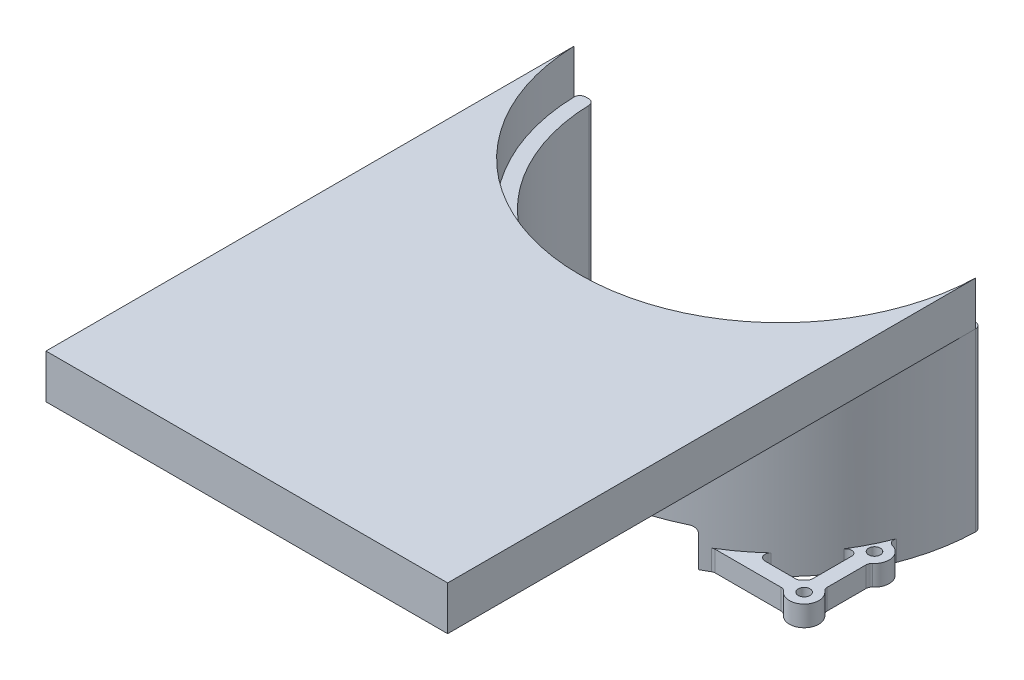
from build123d import *

# Parameters (mm, degrees)
SKETCH1_R           = 2
BOSS_EXTRUDE1_DEPTH = 60
CUT_EXTRUDE1_START  = -53
SKETCH2_R           = 90.041166502
SKETCH2_R_2         = 68.5
CUT_EXTRUDE1_DEPTH  = 53
SKETCH3_W           = 64.67850159
SKETCH3_H           = 25.422058074
CUT_EXTRUDE2_DEPTH  = 55
FILLET1_R           = 2
BOSS_EXTRUDE2_DEPTH = 15


with BuildPart() as part:
    # Sketch1 → Boss-Extrude1 (new body)
    with BuildSketch(Plane(origin=(0, 0, 0), x_dir=(1, 0, 0), z_dir=(0, 1, 0))):
        with BuildLine():
            Line((63.490136384, 0), (68.5, 0))
            ThreePointArc((68.5, 0), (67.085865229, -13.846901692), (62.90184857, -27.122084109))
            ThreePointArc((62.90184857, -27.122084109), (68.657126641, -30.180337544), (66.499734232, -36.330280449))
            Line((66.499734232, -36.330280449), (66.499734232, -51.669719551))
            ThreePointArc((66.499734232, -51.669719551), (67.535642402, -59.535425407), (59.669872981, -58.5))
            Line((59.669872981, -58.5), (35.637059362, -58.5))
            ThreePointArc((35.637059362, -58.5), (0, -68.5), (-35.637059362, -58.5))
            Line((-35.637059362, -58.5), (-59.669872981, -58.5))
            ThreePointArc((-59.669872981, -58.5), (-67.535642402, -59.535425407), (-66.499734232, -51.669719551))
            Line((-66.499734232, -51.669719551), (-66.499734232, -36.330280449))
            ThreePointArc((-66.499734232, -36.330280449), (-68.657126641, -30.180337544), (-62.90184857, -27.122084109))
            ThreePointArc((-62.90184857, -27.122084109), (-67.085865229, -13.846901692), (-68.5, 0))
            Line((-68.5, 0), (-63.490136384, 0))
            ThreePointArc((-63.490136384, 0), (0, -63.490136384), (63.490136384, 0))
        make_face()
        with Locations(Location((-64, -32, 0), (0, 0, 270))):
            Circle(SKETCH1_R, mode=Mode.SUBTRACT)
        with Locations(Location((64, -32, 0), (0, 0, 270))):
            Circle(SKETCH1_R, mode=Mode.SUBTRACT)
        with Locations(Location((64, -56, 0), (0, 0, 270))):
            Circle(SKETCH1_R, mode=Mode.SUBTRACT)
        with Locations(Location((-64, -56, 0), (0, 0, 270))):
            Circle(SKETCH1_R, mode=Mode.SUBTRACT)
        with BuildLine():
            Line((61.500265768, -36.330280449), (61.500265768, -51.669719551))
            ThreePointArc((61.500265768, -51.669719551), (60.464574593, -52.464357598), (59.669872981, -53.5))
            Line((59.669872981, -53.5), (42.778499272, -53.5))
            ThreePointArc((42.778499272, -53.5), (52.025817799, -44.55967103), (59.43877643, -34.048228391))
            ThreePointArc((59.43877643, -34.048228391), (60.289714071, -35.35168291), (61.500265768, -36.330280449))
        make_face(mode=Mode.SUBTRACT)
        with BuildLine():
            Line((-59.669872981, -53.5), (-42.778499272, -53.5))
            ThreePointArc((-42.778499272, -53.5), (-52.025817799, -44.55967103), (-59.43877643, -34.048228391))
            ThreePointArc((-59.43877643, -34.048228391), (-60.289714071, -35.35168291), (-61.500265768, -36.330280449))
            Line((-61.500265768, -36.330280449), (-61.500265768, -51.669719551))
            ThreePointArc((-61.500265768, -51.669719551), (-60.464574593, -52.464357598), (-59.669872981, -53.5))
        make_face(mode=Mode.SUBTRACT)
    extrude(amount=BOSS_EXTRUDE1_DEPTH)

    # Sketch2 → Cut-Extrude1 (cut)
    with BuildSketch(Plane(origin=(0, 60, 0), x_dir=(1, 0, 0), z_dir=(0, 1, 0)).offset(CUT_EXTRUDE1_START)):
        Circle(SKETCH2_R)
        Circle(SKETCH2_R_2, mode=Mode.SUBTRACT)
    extrude(amount=CUT_EXTRUDE1_DEPTH, mode=Mode.SUBTRACT)

    # Sketch3 → Cut-Extrude2 (cut)
    with BuildSketch(Plane(origin=(0, 60, 68.5), x_dir=(1, 0, 0), z_dir=(0, 0, 1))):
        with Locations((0, -60)):
            Rectangle(SKETCH3_W, SKETCH3_H)
    extrude(amount=-CUT_EXTRUDE2_DEPTH, mode=Mode.SUBTRACT)

    # Fillet1
    # the kernel refuses this fillet: 2 mm, written as the material it adds along each edge
    with BuildSketch(Plane(origin=(62.90184857, 0, 27.122084109), x_dir=(0.9997743783027363, 0, 0.02124129208351232), z_dir=(0, 1, 0))) as fillet1_piece_1:
        with BuildLine():
            CenterArc((2.883640558, 1.941395669), FILLET1_R, 160.236767208, 95.858786022)
            ThreePointArc((1.001444665, 2.617663827), (0.514111494, 1.303709596), (0, 0))
            ThreePointArc((0, 0), (1.201516899, 0.146510828), (2.403033798, 0))
        make_face()
    extrude(amount=7)
    with BuildSketch(Plane(origin=(66.499734232, 0, 36.330280449), x_dir=(0.8191578281035011, 0, -0.5735681761192429), z_dir=(0, 1, 0)), Plane(origin=(-66.499734232, 0, 51.669719551), x_dir=(-0.8191578281038059, 0, 0.5735681761188076), z_dir=(0, 1, 0))) as fillet1_piece_2:
        with BuildLine():
            CenterArc((1.046482067, -1.992380453), FILLET1_R, 95.002938786, 49.997638975)
            Line((-0.591833589, -0.845244101), (0, 0))
            ThreePointArc((0, 0), (0.436034195, -0.019048868), (0.87206839, 0))
        make_face()
    extrude(amount=7)
    with BuildSketch(Plane(origin=(66.499734232, 0, 51.669719551), x_dir=(0, 0, -1), z_dir=(0, 1, 0)), Plane(origin=(-66.499734232, 0, 36.330280449), x_dir=(0, 0, 1), z_dir=(0, 1, 0))) as fillet1_piece_3:
        with BuildLine():
            CenterArc((1.031845234, -2), FILLET1_R, 90, 49.997638975)
            ThreePointArc((-0.500190676, -0.714361648), (-0.234491309, -0.368106648), (0, 0))
            Line((0, 0), (1.031845234, 0))
        make_face()
    extrude(amount=7)
    with BuildSketch(Plane(origin=(59.669872981, 0, 58.5), x_dir=(0.5736136140260999, 0, 0.8191260109433204), z_dir=(0, 1, 0))) as fillet1_piece_4:
        with BuildLine():
            CenterArc((1.046411475, -1.992381483), FILLET1_R, 95.002600442, 49.994799115)
            Line((-0.591840547, -0.845154255), (0, 0))
            ThreePointArc((0, 0), (0.436004781, -0.019046293), (0.872009562, 0))
        make_face()
    extrude(amount=7)
    with BuildSketch(Plane(origin=(35.637059362, 0, 58.5), x_dir=(1, 0, 0), z_dir=(0, 1, 0))) as fillet1_piece_5:
        with BuildLine():
            CenterArc((0.556862779, -2), FILLET1_R, 90, 30.889831942)
            ThreePointArc((-0.469915154, -0.283687943), (-0.234673418, -0.142314667), (0, 0))
            Line((0, 0), (0.556862779, 0))
        make_face()
    extrude(amount=7)
    with BuildSketch(Plane(origin=(-35.637059362, 0, 58.5), x_dir=(0.85609218491347, 0, 0.5168231524710181), z_dir=(0, 1, 0))) as fillet1_piece_6:
        with BuildLine():
            CenterArc((0.556920432, -1.999983947), FILLET1_R, 90.229563134, 30.889831942)
            Line((-0.476725873, -0.287799577), (0, 0))
            ThreePointArc((0, 0), (0.274453594, -0.000549818), (0.548907188, 0))
        make_face()
    extrude(amount=7)
    with BuildSketch(Plane(origin=(-59.669872981, 0, 58.5), x_dir=(1, 0, 0), z_dir=(0, 1, 0))) as fillet1_piece_7:
        with BuildLine():
            CenterArc((1.031775628, -2), FILLET1_R, 90, 49.994799115)
            ThreePointArc((-0.500196557, -0.714285714), (-0.234496964, -0.36806807), (0, 0))
            Line((0, 0), (1.031775628, 0))
        make_face()
    extrude(amount=7)
    with BuildSketch(Plane(origin=(-62.90184857, 0, 27.122084109), x_dir=(-0.3770742927095456, 0, -0.9261830152716016), z_dir=(0, 1, 0))) as fillet1_piece_8:
        with BuildLine():
            CenterArc((2.843602303, 1.999581444), FILLET1_R, 172.968999754, 95.858786022)
            ThreePointArc((0.858642167, 2.244394142), (0.566159793, 1.069846424), (0, 0))
            ThreePointArc((0, 0), (1.401343581, 0.014335543), (2.802687162, 0))
        make_face()
    extrude(amount=7)
    with BuildSketch(Plane(origin=(32.339250795, 12.711029037, 65.385617973), x_dir=(-1, 0, 0), z_dir=(0, 0, -1))) as fillet1_piece_9_section:
        with BuildLine():
            CenterArc((FILLET1_R, -FILLET1_R), FILLET1_R, 90, 90)
            Line((0, -FILLET1_R), (0, 0))
            Line((0, 0), (FILLET1_R, 0))
        make_face()
    fillet1_piece_9 = extrude(amount=15.748906176, mode=Mode.PRIVATE)
    fillet1_piece_9 = fillet1_piece_9 & Plane(origin=(0, 12.25719498, 0), x_dir=(1, 0, 0), z_dir=(0, -1, 0)) * Cylinder(68.5, 40, mode=Mode.PRIVATE)
    fillet1_piece_9 = fillet1_piece_9 - Plane(origin=(0, 12.25719498, 0), x_dir=(-1, 0, 0), z_dir=(0, -1, 0)) * Cylinder(63.490136384, 40, mode=Mode.PRIVATE)
    add(fillet1_piece_9)
    with BuildSketch(Plane(origin=(-32.339250795, 12.711029037, 65.385617973), x_dir=(1, 0, 0), z_dir=(0, 0, -1))) as fillet1_piece_10_section:
        with BuildLine():
            CenterArc((FILLET1_R, FILLET1_R), FILLET1_R, 180, 90)
            Line((0, FILLET1_R), (0, 0))
            Line((0, 0), (FILLET1_R, 0))
        make_face()
    fillet1_piece_10 = extrude(amount=15.748906176, mode=Mode.PRIVATE)
    fillet1_piece_10 = fillet1_piece_10 & Plane(origin=(0, 12.25719498, 0), x_dir=(1, 0, 0), z_dir=(0, -1, 0)) * Cylinder(68.5, 40, mode=Mode.PRIVATE)
    fillet1_piece_10 = fillet1_piece_10 - Plane(origin=(0, 12.25719498, 0), x_dir=(-1, 0, 0), z_dir=(0, -1, 0)) * Cylinder(63.490136384, 40, mode=Mode.PRIVATE)
    add(fillet1_piece_10)
    with BuildSketch(Plane(origin=(-61.500265768, 0, 36.330280449), x_dir=(0, 0, 1), z_dir=(0, 1, 0)), Plane(origin=(61.500265768, 0, 51.669719551), x_dir=(0, 0, -1), z_dir=(0, 1, 0))) as fillet1_piece_11:
        with BuildLine():
            CenterArc((1.031845234, 2), FILLET1_R, 220.002361025, 49.997638975)
            ThreePointArc((-0.500190676, 0.714361648), (-0.234491309, 0.368106648), (0, 0))
            Line((0, 0), (1.031845234, 0))
        make_face()
    extrude(amount=7)
    with BuildSketch(Plane(origin=(-61.500265768, 0, 51.669719551), x_dir=(0.8191578281038006, 0, 0.5735681761188153), z_dir=(0, 1, 0)), Plane(origin=(61.500265768, 0, 36.330280449), x_dir=(-0.8191578281034525, 0, -0.5735681761193124), z_dir=(0, 1, 0))) as fillet1_piece_12:
        with BuildLine():
            CenterArc((1.046482067, 1.992380453), FILLET1_R, 214.999422238, 49.997638975)
            Line((-0.591833589, 0.845244101), (0, 0))
            ThreePointArc((0, 0), (0.436034195, 0.019048868), (0.87206839, 0))
        make_face()
    extrude(amount=7)
    with BuildSketch(Plane(origin=(-59.43877643, 0, 34.048228391), x_dir=(0.514701836591563, 0, 0.8573692433305922), z_dir=(0, 1, 0))) as fillet1_piece_13:
        with BuildLine():
            CenterArc((2.843602303, -1.999581444), FILLET1_R, 91.172214224, 95.858786022)
            ThreePointArc((0.858642167, -2.244394142), (0.566159793, -1.069846424), (0, 0))
            ThreePointArc((0, 0), (1.401343581, -0.014335543), (2.802687162, 0))
        make_face()
    extrude(amount=7)
    with BuildSketch(Plane(origin=(-42.778499272, 0, 53.5), x_dir=(-0.7563233086110386, 0, -0.6541980226595399), z_dir=(0, 1, 0))) as fillet1_piece_14:
        with BuildLine():
            CenterArc((5.367668856, 1.998508223), FILLET1_R, 130.858867725, 136.928029694)
            Line((4.05927281, 3.51115484), (0, 0))
            ThreePointArc((0, 0), (2.645218105, 0.051093353), (5.29043621, 0))
        make_face()
    extrude(amount=7)
    with BuildSketch(Plane(origin=(-59.669872981, 0, 53.5), x_dir=(1, 0, 0), z_dir=(0, 1, 0))) as fillet1_piece_15:
        with BuildLine():
            CenterArc((1.031775628, 2), FILLET1_R, 220.005200885, 49.994799115)
            ThreePointArc((-0.500196557, 0.714285714), (-0.234496964, 0.36806807), (0, 0))
            Line((0, 0), (1.031775628, 0))
        make_face()
    extrude(amount=7)
    with BuildSketch(Plane(origin=(59.669872981, 0, 53.5), x_dir=(0.5736136140255318, 0, -0.8191260109437182), z_dir=(0, 1, 0))) as fillet1_piece_16:
        with BuildLine():
            CenterArc((1.046411475, 1.992381483), FILLET1_R, 215.002600442, 49.994799115)
            Line((-0.591840547, 0.845154255), (0, 0))
            ThreePointArc((0, 0), (0.436004781, 0.019046293), (0.872009562, 0))
        make_face()
    extrude(amount=7)
    with BuildSketch(Plane(origin=(42.778499272, 0, 53.5), x_dir=(0.7563233086109976, 0, -0.654198022659587), z_dir=(0, 1, 0))) as fillet1_piece_17:
        with BuildLine():
            CenterArc((5.367668856, -1.998508223), FILLET1_R, 92.213102581, 136.928029694)
            Line((4.05927281, -3.51115484), (0, 0))
            ThreePointArc((0, 0), (2.645218105, -0.051093353), (5.29043621, 0))
        make_face()
    extrude(amount=7)
    with BuildSketch(Plane(origin=(59.43877643, 0, 34.048228391), x_dir=(0.6168576606483469, 0, 0.7870747273921637), z_dir=(0, 1, 0))) as fillet1_piece_18:
        with BuildLine():
            CenterArc((2.883640558, -1.941395669), FILLET1_R, 103.904446769, 95.858786022)
            ThreePointArc((1.001444665, -2.617663827), (0.514111494, -1.303709596), (0, 0))
            ThreePointArc((0, 0), (1.201516899, -0.146510828), (2.403033798, 0))
        make_face()
    extrude(amount=7)
    # the kernel refuses this fillet: 2 mm, written as the material it takes off along each edge
    with BuildSketch(Plane(origin=(63.490136384, -4.923634816, 0), x_dir=(1, 0, 0), z_dir=(0, 1, 0))) as fillet1_2_piece_1:
        with BuildLine():
            CenterArc((1.969453926, -2), FILLET1_R, 90, 88.249974963)
            ThreePointArc((-0.029613229, -1.9389221), (-0.007403739, -0.969574114), (0, 0))
            Line((0, 0), (1.969453926, 0))
        make_face()
    extrude(amount=69.847269632, mode=Mode.SUBTRACT)
    with BuildSketch(Plane(origin=(68.5, 65.150958496, 0), x_dir=(-1, 0, 0), z_dir=(0, -1, 0)), Plane(origin=(-68.5, -5.150958496, 0), x_dir=(1, 0, 0), z_dir=(0, 1, 0))) as fillet1_2_piece_2:
        with BuildLine():
            CenterArc((2.030081992, -2), FILLET1_R, 90, 91.723441219)
            ThreePointArc((0.030986713, -2.060150376), (0.007747116, -1.030191699), (0, 0))
            Line((0, 0), (2.030081992, 0))
        make_face()
    extrude(amount=70.301916991, mode=Mode.SUBTRACT)
    with BuildSketch(Plane(origin=(-63.490136384, -4.923634816, 0), x_dir=(-1, 0, 0), z_dir=(0, 1, 0))) as fillet1_2_piece_3:
        with BuildLine():
            CenterArc((1.969453926, 2), FILLET1_R, 181.750025037, 88.249974963)
            ThreePointArc((-0.029613229, 1.9389221), (-0.007403739, 0.969574114), (0, 0))
            Line((0, 0), (1.969453926, 0))
        make_face()
    extrude(amount=69.847269632, mode=Mode.SUBTRACT)


with BuildPart() as body_2:
    # Sketch4 → Boss-Extrude2 (new body)
    with BuildSketch(Plane(origin=(0, 60, 0), x_dir=(1, 0, 0), z_dir=(0, 1, 0))):
        with BuildLine():
            Line((-68.469013287, -2.060150376), (-68.469013287, -182.060150376))
            Line((-68.469013287, -182.060150376), (68.5, -182.060150376))
            Line((68.5, -182.060150376), (68.469013287, -2.060150376))
            ThreePointArc((68.469013287, -2.060150376), (0, -68.5), (-68.469013287, -2.060150376))
        make_face()
    extrude(amount=BOSS_EXTRUDE2_DEPTH)


solid = Compound([part.part, body_2.part])
